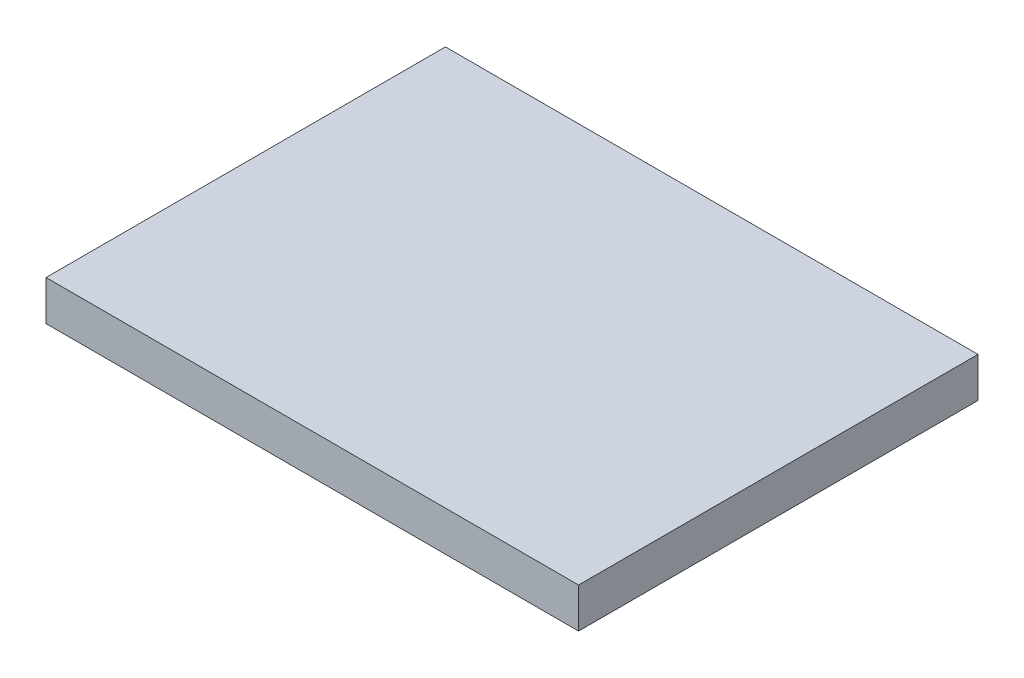
from build123d import *

# Parameters (mm, degrees)
SKETCH1_W           = 20
SKETCH1_H           = 15
BOSS_EXTRUDE1_DEPTH = 1.5


with BuildPart() as part:
    # Sketch1 → Boss-Extrude1 (new body)
    with BuildSketch(Plane(origin=(0, 0, 0), x_dir=(1, 0, 0), z_dir=(0, 1, 0))):
        Rectangle(SKETCH1_W, SKETCH1_H)
    extrude(amount=BOSS_EXTRUDE1_DEPTH)


solid = part.part
